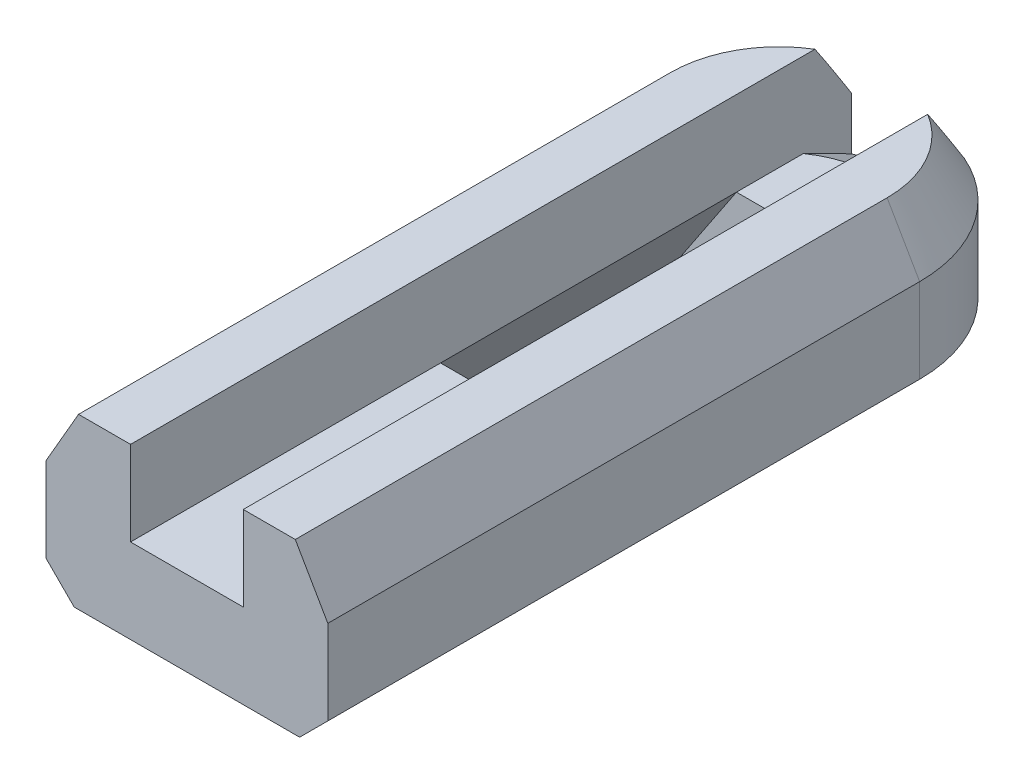
from build123d import *

# Parameters (mm, degrees)
EXTRUDE2_DEPTH                 = 26
CUT_EXTRUDE3_DEPTH             = 28.147743921
CHAMFER1_SIZE                  = 1
CHAMFER2_SIZE2                 = 1.154700538
CHAMFER2_SIZE                  = 2
CHAMFER3_SIZE2                 = 1.154700538
CHAMFER3_SIZE                  = 2
CHAMFER4_SIZE                  = 1.5
CHAMFER4_SIZE2                 = 0.866025404
CUT_EXTRUDE5_REACH             = 29.148
CUT_EXTRUDE5_DIRECTION_2_REACH = 29.148
CUT_EXTRUDE6_START             = 4.5
CUT_EXTRUDE6_DEPTH             = 10.5
CUT_EXTRUDE6_START_2           = 15
CUT_EXTRUDE6_2_DEPTH           = 3
CUT_EXTRUDE6_START_3           = -4
CUT_EXTRUDE6_3_DEPTH           = 8


with BuildPart() as part:
    # Sketch1 → Extrude2 (new body)
    with BuildSketch(Plane.XY):
        Polygon((-5, 0), (5, 0), (5, 6), (2, 6), (2, 3), (-2, 3), (-2, 6), (-5, 6), align=None)
    extrude(amount=EXTRUDE2_DEPTH)

    # Sketch2 → Cut-Extrude3 (cut, through all)
    with BuildSketch(Plane(origin=(0, 0, 0), x_dir=(1, 0, 0), z_dir=(0, 1, 0))):
        with BuildLine():
            Line((-5, 1), (5, 1))
            Line((5, 1), (5, -5))
            ThreePointArc((5, -5), (0, 0), (-5, -5))
            Line((-5, -5), (-5, 1))
        make_face()
    extrude(amount=CUT_EXTRUDE3_DEPTH, mode=Mode.SUBTRACT)

    # Chamfer1
    chamfer1_edges = [part.edges().sort_by_distance(p)[0] for p in [
        (5, 0, 15.5),
        (-5, 0, 15.5),
        (0, 0, 0),
    ]]
    chamfer(chamfer1_edges, length=CHAMFER1_SIZE)

    # Chamfer2
    chamfer2_edges = [part.edges().sort_by_distance(p)[0] for p in [
        (5, 6, 15.5),
        (4.183300133, 6, 2.261387212),
    ]]
    chamfer(chamfer2_edges, length=CHAMFER2_SIZE, length2=CHAMFER2_SIZE2)

    # Chamfer3
    chamfer3_edges = [part.edges().sort_by_distance(p)[0] for p in [
        (-5, 6, 15.5),
        (-4.183300133, 6, 2.261387212),
    ]]
    chamfer(chamfer3_edges, length=CHAMFER3_SIZE, length2=CHAMFER3_SIZE2)

    # Chamfer4
    chamfer4_edges = [part.edges().sort_by_distance(p)[0] for p in [
        (0, 3, 0),
    ]]
    chamfer4_side = [part.faces().sort_by_distance(p)[0] for p in [
        (0, 3, 13.068070345),
    ]]
    chamfer(chamfer4_edges, length=CHAMFER4_SIZE, length2=CHAMFER4_SIZE2, reference=chamfer4_side[0])

    # Cut-Extrude5: up to this face of the body (flat: up to its plane)
    cut_extrude5_end = Plane(part.part.faces().sort_by_distance((-2, 4.468849855, 13.300187557))[0])
    # Sketch5 → Cut-Extrude5 (cut, up to the picked face)
    with BuildSketch(Plane(origin=(0, 0, 0), x_dir=(0, 0, -1), z_dir=(1, 0, 0)), mode=Mode.PRIVATE) as cut_extrude5_sk1:
        with BuildLine():
            Line((-15, 3), (-14, 3))
            Line((-14, 3), (-14, 0))
            Line((-14, 0), (-18, 0))
            ThreePointArc((-18, 0), (-15.878679656, 0.878679656), (-15, 3))
        make_face()
    cut_extrude5_tool1 = split(extrude(cut_extrude5_sk1.sketch, amount=-CUT_EXTRUDE5_REACH, mode=Mode.PRIVATE), bisect_by=cut_extrude5_end, keep=Keep.BOTH, mode=Mode.PRIVATE)
    add(cut_extrude5_tool1.solids().sort_by(Axis((0, 1.174967, 14.958278), (-1, 0, 0)))[0], mode=Mode.SUBTRACT)

    # Cut-Extrude5 direction 2: up to this face of the body (flat: up to its plane)
    cut_extrude5_direction_2_end = Plane(part.part.faces().sort_by_distance((2, 4.468849855, 13.300187557))[0])
    # Sketch5 → Cut-Extrude5 direction 2 (cut, up to the picked face)
    with BuildSketch(Plane(origin=(0, 0, 0), x_dir=(0, 0, -1), z_dir=(1, 0, 0)), mode=Mode.PRIVATE) as cut_extrude5_direction_2_sk1:
        with BuildLine():
            Line((-15, 3), (-14, 3))
            Line((-14, 3), (-14, 0))
            Line((-14, 0), (-18, 0))
            ThreePointArc((-18, 0), (-15.878679656, 0.878679656), (-15, 3))
        make_face()
    cut_extrude5_direction_2_tool1 = split(extrude(cut_extrude5_direction_2_sk1.sketch, amount=CUT_EXTRUDE5_DIRECTION_2_REACH, mode=Mode.PRIVATE), bisect_by=cut_extrude5_direction_2_end, keep=Keep.BOTH, mode=Mode.PRIVATE)
    add(cut_extrude5_direction_2_tool1.solids().sort_by(Axis((0, 1.174967, 14.958278), (1, 0, 0)))[0], mode=Mode.SUBTRACT)

    # Cut-Extrude6: read off the stored shape, not the designer's step
    # Cut-Extrude6 outline → Cut-Extrude6 (cut)
    with BuildSketch(Plane.XY.offset(CUT_EXTRUDE6_START)):
        Polygon((-2, 3), (-4, 0), (4, 0), (2, 3), align=None)
    extrude(amount=CUT_EXTRUDE6_DEPTH, mode=Mode.SUBTRACT)

    # Cut-Extrude6 2 outline → Cut-Extrude6 2 (cut)
    with BuildSketch(Plane.XY.offset(CUT_EXTRUDE6_START_2)):
        Polygon((2, 3), (2, 0), (4, 0), align=None)
        Polygon((-2, 3), (-4, 0), (-2, 0), align=None)
    extrude(amount=CUT_EXTRUDE6_2_DEPTH, mode=Mode.SUBTRACT)

    # Cut-Extrude6 3 outline → Cut-Extrude6 3 (add)
    with BuildSketch(Plane.YZ.offset(CUT_EXTRUDE6_START_3)):
        with BuildLine():
            ThreePointArc((0, 18), (0.878679656, 15.878679656), (3, 15))
            Line((3, 15), (3, 18))
            Line((3, 18), (0, 18))
        make_face()
    extrude(amount=CUT_EXTRUDE6_3_DEPTH)


solid = part.part
